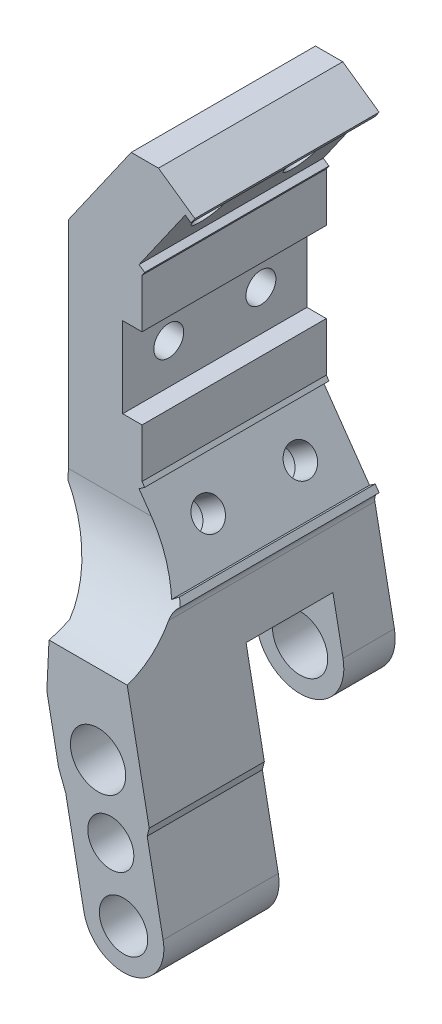
from build123d import *

# Parameters (mm, degrees)
SKETCH_1_R                = 12.000000000000052
EXTRUDE_1_DEPTH           = 110
SKETCH_79_R               = 10.500000000000002
CUT_EXTRUDE_45_DEPTH      = 119.99999999999999
EXTRUDE_2_DEPTH           = 110
CUT_EXTRUDE_46_DEPTH      = 89
CUT_EXTRUDE_46_DEPTH_BACK = 89
CUT_EXTRUDE_48_DEPTH      = 239.00000000000009
CUT_EXTRUDE_49_DEPTH      = 239.00000000000009
SKETCH_93_R               = 6.500000000000001
SKETCH_93_R_2             = 6.499999999999999
CUT_EXTRUDE_50_DEPTH      = 239.00000000000009
SKETCH_94_R               = 9.999999999999993
SKETCH_94_R_2             = 9.999999999999998
CUT_EXTRUDE_51_DEPTH      = 20
SKETCH_95_R               = 6.500000000000009
SKETCH_95_R_2             = 6.500000000000005
CUT_EXTRUDE_52_DEPTH      = 62.00000000000001
SKETCH_96_R               = 10
SKETCH_96_R_2             = 10.000000000000004
CUT_EXTRUDE_53_DEPTH      = 26
SKETCH_97_R               = 6.500000000000009
SKETCH_97_R_2             = 6.500000000000005
CUT_EXTRUDE_54_DEPTH      = 52.00000000000001
CHAMFER_3_SIZE            = 15
CHAMFER_3_SIZE2           = 6.9946148723250126
CUT_EXTRUDE_56_DEPTH      = 40.000000000000014
CHAMFER_4_SIZE            = 17
CHAMFER_4_SIZE2           = 2.99755867204391
CUT_EXTRUDE_57_DEPTH      = 99.99999999999999
CUT_EXTRUDE_60_DEPTH      = 311.81665269220883
CUT_EXTRUDE_61_DEPTH      = 30
FILLET_5_R                = 19
SKETCH_106_R              = 2
SKETCH_106_R_2            = 2.0000000000000018
CUT_EXTRUDE_62_DEPTH      = 9.999999999999996
EXTRUDE_3_DEPTH           = 50
EXTRUDE_4_DEPTH           = 80
SKETCH_110_R              = 6.500000000000003
SKETCH_110_R_2            = 6.500000000000009
CUT_EXTRUDE_63_DEPTH      = 80
SKETCH_111_R              = 9.999999999999996
SKETCH_111_R_2            = 9.999999999999993
CUT_EXTRUDE_64_DEPTH      = 18
FILLET_7_R                = 40
CUT_EXTRUDE_65_DEPTH      = 313.378967275511
CUT_EXTRUDE_66_DEPTH      = 313.378967275511
SKETCH_114_R              = 10
CUT_EXTRUDE_67_DEPTH      = 313.378967275511
CUT_EXTRUDE_68_DEPTH      = 304.118160452512
CUT_EXTRUDE_69_DEPTH      = 313.378967275511
FILLET_8_R                = 4


# Some blends are built 0.0001 mm under size
with BuildPart() as part:
    # 草图1 → 拉伸1 (new body)
    with BuildSketch(Plane.XY):
        with BuildLine():
            Line((-28.976730988546294, -151.6118545806237), (-4.886520661802549, -186.0162404407615))
            Line((-4.886520661802549, -186.0162404407615), (12.286288922085955, -274.36268695105133))
            ThreePointArc((12.286288922085955, -274.36268695105133), (31.04526778327323, -287.0157779601894), (43.69835879241124, -268.2567990990021))
            Line((43.69835879241124, -268.2567990990021), (21.02326901145373, -151.60357490388574))
            Line((21.02326901145373, -151.60357490388574), (6.0232690114537295, -130.18135480275444))
            Line((6.0232690114537295, -130.18135480275444), (6.023269011453701, -52.647312191388025))
            Line((6.023269011453701, -52.647312191388025), (28.96632646549536, -19.88123041982822))
            Line((28.96632646549536, -19.88123041982822), (0.2960049153805317, 0.19394485245823218))
            Line((0.2960049153805317, 0.19394485245823218), (-28.976730988546297, -41.61185458062371))
            Line((-28.976730988546297, -41.61185458062371), (-28.976730988546294, -151.6118545806237))
        make_face()
        with Locations((16.925402125409377, -214.37536638506216)):
            Circle(SKETCH_1_R, mode=Mode.SUBTRACT)
    extrude(amount=EXTRUDE_1_DEPTH)

    # 草图79 → 切除-拉伸45 (cut)
    with BuildSketch(Plane.XY.offset(110)):
        with Locations((27.992323857248604, -271.30974302502676)):
            Circle(SKETCH_79_R)
    extrude(amount=-CUT_EXTRUDE_45_DEPTH, mode=Mode.SUBTRACT)

    # 草图84 → 拉伸2 (add)
    with BuildSketch(Plane.XY.offset(110)):
        Polygon((33.77886656613756, -180.53953408076273), (44.27305222911856, -234.5274390775936), (37.40166194498491, -235.86310204522937), (21.02326901145373, -151.60357490388574), (30.894607438439262, -165.70130720226234), align=None)
        Polygon((5.989592074660176, -241.96898989727842), (3.0447105243171797, -242.54141688340803), (-9.11709427336755, -179.97435517002904), (-4.886520661802549, -186.0162404407615), (-4.169019446852941, -189.7074641975933), align=None)
    extrude(amount=-EXTRUDE_2_DEPTH)

    # 草图87 → 切除-拉伸46 (cut, two sides: drawn at the far end of the back side and taken through both)
    with BuildSketch(Plane(origin=(-8.13799706766443, -1.5818663857744035, 0), x_dir=(0, 0, -1), z_dir=(0.9816271834476652, 0.1908089953765384, 0)).offset(-CUT_EXTRUDE_46_DEPTH_BACK)):
        Polygon((-60, -287.6662060810232), (-60, -190.66620608102318), (-22.300000000000004, -190.66620608102318), (-22.299999999999986, -287.6662060810232), align=None)
    extrude(amount=CUT_EXTRUDE_46_DEPTH + CUT_EXTRUDE_46_DEPTH_BACK, mode=Mode.SUBTRACT)

    # 草图91 → 切除-拉伸48 (cut)
    with BuildSketch(Plane(origin=(0, 0, 0), x_dir=(-1, 0, 0), z_dir=(0, 0, -1))):
        Polygon((-27.245597156442233, -22.338686552695204), (-24.78814102357525, -20.61795724364208), (-4.7129657512888, -49.2882787937569), (-7.170421884155786, -51.009008102810036), align=None)
        Polygon((-7.170421884155786, -131.81965889133244), (-27.245597156442233, -160.48998044144724), (-24.78814102357525, -162.21070975050037), (-4.7129657512888, -133.54038820038556), align=None)
    extrude(amount=-CUT_EXTRUDE_48_DEPTH, mode=Mode.SUBTRACT)

    # 草图92 → 切除-拉伸49 (cut)
    with BuildSketch(Plane.XY.offset(110)):
        Polygon((6.0232690114537295, -73.91433349707123), (-2.3767309885462713, -73.91433349707123), (-2.3767309885462713, -108.91433349707124), (6.023269011453734, -108.91433349707124), align=None)
    extrude(amount=-CUT_EXTRUDE_49_DEPTH, mode=Mode.SUBTRACT)

    # 草图93 → 切除-拉伸50 (cut)
    with BuildSketch(Plane(origin=(26.320363423382695, -18.429716877471463, 0), x_dir=(0, 0, -1), z_dir=(0.819152044288995, -0.5735764363510417, 0))):
        with Locations(Location((-60, -20.171348233123158, 0), (0, 0, 90))):
            Circle(SKETCH_93_R)
        with Locations(Location((-20.000000000000004, -20.171348233123165, 0), (0, 0, 90))):
            Circle(SKETCH_93_R_2)
    extrude(amount=-CUT_EXTRUDE_50_DEPTH, mode=Mode.SUBTRACT)

    # 草图94 → 切除-拉伸51 (cut)
    with BuildSketch(Plane(origin=(0.10749800613483755, -0.07527091423812596, 0), x_dir=(0, 0, 1), z_dir=(-0.8191520442889949, 0.5735764363510415, 0))):
        with Locations(Location((60, -20.171348233123386, 0), (0, 0, 270))):
            Circle(SKETCH_94_R)
        with Locations(Location((20, -20.17134823312372, 0), (0, 0, 270))):
            Circle(SKETCH_94_R_2)
    extrude(amount=-CUT_EXTRUDE_51_DEPTH, mode=Mode.SUBTRACT)

    # 草图95 → 切除-拉伸52 (cut)
    with BuildSketch(Plane(origin=(-59.58101119787688, -41.71907317491003, 0), x_dir=(0, 0, -1), z_dir=(0.8191520442889946, 0.5735764363510422, 0))):
        with Locations(Location((-60, -129.59312808976054, 0), (0, 0, 90))):
            Circle(SKETCH_95_R)
        with Locations(Location((-20, -129.59312808976054, 0), (0, 0, 90))):
            Circle(SKETCH_95_R_2)
    extrude(amount=-CUT_EXTRUDE_52_DEPTH, mode=Mode.SUBTRACT)

    # 草图96 → 切除-拉伸53 (cut)
    with BuildSketch(Plane(origin=(-90.67794882371814, -63.493383315761, 0), x_dir=(0, 0, 1), z_dir=(-0.819152044288995, -0.5735764363510415, 0))):
        with Locations(Location((20, -129.59312808976054, 0), (0, 0, 270))):
            Circle(SKETCH_96_R)
        with Locations(Location((60.00000000000001, -129.59312808976054, 0), (0, 0, 270))):
            Circle(SKETCH_96_R_2)
    extrude(amount=-CUT_EXTRUDE_53_DEPTH, mode=Mode.SUBTRACT)

    # 草图97 → 切除-拉伸54 (cut)
    with BuildSketch(Plane(origin=(-2.3767309885462713, 0, 0), x_dir=(0, 0, -1), z_dir=(1, 0, 0))):
        with Locations((-60, -91.41433349707123)):
            Circle(SKETCH_97_R)
        with Locations((-20, -91.41433349707123)):
            Circle(SKETCH_97_R_2)
    extrude(amount=-CUT_EXTRUDE_54_DEPTH, mode=Mode.SUBTRACT)

    # 倒角3
    chamfer_3_edges = [part.edges().sort_by_distance(p)[0] for p in [
        (44.27305222911856, -234.5274390775936, 85),
    ]]
    chamfer_3_side = [part.faces().sort_by_distance(p)[0] for p in [
        (44.02415054875298, -233.24695093828697, 85),
    ]]
    chamfer(chamfer_3_edges, length=CHAMFER_3_SIZE, length2=CHAMFER_3_SIZE2, reference=chamfer_3_side[0])

    # 草图100 → 切除-拉伸56 (cut)
    with BuildSketch(Plane(origin=(0, 0, 0), x_dir=(-1, 0, 0), z_dir=(0, 0, -1))):
        Polygon((-44.27305222911856, -234.52743907759367), (6.1852097610321, -243.4245920661131), (-1.3934863042614487, -301.9028620974419), (-49.163357209015906, -290.65730281259704), align=None)
    extrude(amount=-CUT_EXTRUDE_56_DEPTH, mode=Mode.SUBTRACT)

    # 倒角4
    chamfer_4_edges = [part.edges().sort_by_distance(p)[0] for p in [
        (3.0447105243171797, -242.54141688340803, 85),
    ]]
    chamfer_4_side = [part.faces().sort_by_distance(p)[0] for p in [
        (-3.0361918745251857, -211.25788602671855, 108.72867994952558),
    ]]
    chamfer(chamfer_4_edges, length=CHAMFER_4_SIZE, length2=CHAMFER_4_SIZE2, reference=chamfer_4_side[0])

    # 草图101 → 切除-拉伸57 (cut)
    with BuildSketch(Plane.ZY.offset(28.976730988546297)):
        Polygon((80, 0.19394485245823218), (80.00000000000003, -179.97435517002904), (110, -179.97435517002904), (110, 0.19394485245823218), align=None)
    extrude(amount=-CUT_EXTRUDE_57_DEPTH, mode=Mode.SUBTRACT)

    # 草图104 → 切除-拉伸60 (cut, through all)
    with BuildSketch(Plane(origin=(0, 0, 0), x_dir=(-1, 0, 0), z_dir=(0, 0, -1))):
        Polygon((-32.2371611918256, -193.57151976257379), (-38.9154760300042, -227.92847118324212), (-40.33322116171547, -235.2221375942102), (-44.27305222911856, -234.52743907759367), (-30.894607438439262, -165.70130720226234), (-28.966326465495353, -162.94743657431422), align=None)
    extrude(amount=-CUT_EXTRUDE_60_DEPTH, mode=Mode.SUBTRACT)

    # 草图105 → 切除-拉伸61 (cut)
    with BuildSketch(Plane(origin=(0, 0, 0), x_dir=(-1, 0, 0), z_dir=(0, 0, -1))):
        Polygon((-20.550773037563566, -233.02628287056783), (19.175397031592663, -240.74826808946762), (4.5304915840304885, -248.72140725810314), (-58.40232940975858, -238.94714512920513), (-58.40232940975858, -225.6686856415971), align=None)
    extrude(amount=-CUT_EXTRUDE_61_DEPTH, mode=Mode.SUBTRACT)

    # 圆角5
    fillet_5_edges = [part.edges().sort_by_distance(p)[0] for p in [
        (1.8998565520579558, -236.651653782722, 11.149999999999999),
        (39.20168952306901, -229.40091195841367, 11.150000000000002),
    ]]
    fillet(fillet_5_edges, radius=FILLET_5_R - 0.0001)  # a hair under: the kernel refuses the full size

    # 草图106 → 切除-拉伸62 (cut)
    with BuildSketch(Plane(origin=(0, 0, 0), x_dir=(-1, 0, 0), z_dir=(0, 0, -1))):
        with Locations((-14.063267194761234, -199.6509586333472)):
            Circle(SKETCH_106_R)
        with Locations(Location((-19.78753705605748, -229.0997741367771, 0), (0, 0, 180))):
            Circle(SKETCH_106_R_2)
    extrude(amount=-CUT_EXTRUDE_62_DEPTH, mode=Mode.SUBTRACT)

    # 草图108 → 拉伸3 (add)
    with BuildSketch(Plane(origin=(0, 0, 60), x_dir=(-1, 0, 0), z_dir=(0, 0, -1))):
        with BuildLine():
            Line((-38.26406077084946, -232.42438348743354), (-37.40166194498552, -235.8631020452294))
            Line((-37.40166194498552, -235.8631020452294), (-43.69835879241125, -268.25679909900214))
            ThreePointArc((-43.69835879241125, -268.25679909900214), (-31.045267783273236, -287.0157779601894), (-12.286288922085975, -274.3626869510514))
            Line((-12.286288922085975, -274.3626869510514), (-5.989592074660176, -241.96898989727842))
            Line((-5.989592074660176, -241.96898989727842), (-2.8958579304012813, -233.91437207733833))
            Line((-2.8958579304012813, -233.91437207733833), (-3.4359003256881757, -236.69264935080582))
            Line((-3.4359003256881757, -236.69264935080582), (-10.813848146914486, -274.64890044411624))
            ThreePointArc((-10.813848146914486, -274.64890044411624), (-31.331481276338053, -288.4882187353609), (-45.170799567582726, -267.97058560593734))
            Line((-45.170799567582726, -267.97058560593734), (-38.26406077084946, -232.42438348743354))
        make_face()
    extrude(amount=-EXTRUDE_3_DEPTH)

    # 草图109 → 拉伸4 (add)
    with BuildSketch(Plane(origin=(0, 0, 0), x_dir=(-1, 0, 0), z_dir=(0, 0, -1))):
        Polygon((28.976730988546297, -41.61185458062371), (31.976730988546294, -45.8962986008501), (31.976730988546283, -147.3274105603974), (28.976730988546294, -151.6118545806237), align=None)
    extrude(amount=-EXTRUDE_4_DEPTH)

    # 草图110 → 切除-拉伸63 (cut)
    with BuildSketch(Plane(origin=(-2.3767309885462713, 0, 0), x_dir=(0, 0, -1), z_dir=(1, 0, 0))):
        with Locations((-60, -91.41433349707123)):
            Circle(SKETCH_110_R)
        with Locations((-20, -91.41433349707123)):
            Circle(SKETCH_110_R_2)
    extrude(amount=-CUT_EXTRUDE_63_DEPTH, mode=Mode.SUBTRACT)

    # 草图111 → 切除-拉伸64 (cut)
    with BuildSketch(Plane.ZY.offset(31.9767309885463)):
        with Locations(Location((20, -91.41433349707123, 0), (0, 0, 270))):
            Circle(SKETCH_111_R)
        with Locations(Location((60, -91.41433349707123, 0), (0, 0, 270))):
            Circle(SKETCH_111_R_2)
    extrude(amount=-CUT_EXTRUDE_64_DEPTH, mode=Mode.SUBTRACT)

    # 圆角7
    # the kernel refuses this fillet: 40 mm, written as the material it adds along each edge
    with BuildSketch(Plane(origin=(-105.94167792855299, -179.97435517002904, 80.00000000000003), x_dir=(0, 0, 1), z_dir=(1, 3e-17, 0))) as fillet_7_piece_1_section:
        with BuildLine():
            CenterArc((40, -38.72983346207417), FILLET_7_R, 104.47751218592997, 75.52248781407003)
            Line((0, -38.72983346207417), (-0.7999999999999972, -38.72983346207417))
            Line((-0.7999999999999972, -38.72983346207417), (-0.7999999999999972, 0))
            Line((-0.7999999999999972, 0), (0, 0.8000000000000114))
            ThreePointArc((0, 0.8000000000000114), (14.999999999999986, 0.8000000000000114), (29.79999999999997, 0.7745966692414754))
            Line((29.79999999999997, 0.7745966692414754), (29.99999999999997, 0))
        make_face()
    fillet_7_piece_1 = extrude(amount=233.55116450368297, mode=Mode.PRIVATE)
    fillet_7_piece_1 = split(fillet_7_piece_1, bisect_by=Plane(origin=(-12.51953329492531, -162.47032383757914, 83.83192284371052), z_dir=(-0.9816271834476656, -0.19080899537653592, 0)), keep=Keep.TOP, mode=Mode.PRIVATE)
    fillet_7_piece_1 = split(fillet_7_piece_1, bisect_by=Plane(origin=(-19.41668158240532, -165.26502008436023, 83.83192284371052), z_dir=(0.8191520442889951, 0.5735764363510417, 0)), keep=Keep.TOP, mode=Mode.PRIVATE)
    fillet_7_piece_1 = split(fillet_7_piece_1, bisect_by=Plane(origin=(-31.976730988546283, -163.2522374406607, 83.83192284371052), z_dir=(1, 1.1e-16, 0)), keep=Keep.TOP, mode=Mode.PRIVATE)
    add(fillet_7_piece_1)
    with BuildSketch(Plane(origin=(-105.94167792855299, -179.97435517002904, 80.00000000000003), x_dir=(0, 0, 1), z_dir=(1, 3e-17, 0))) as fillet_7_piece_2_section:
        with BuildLine():
            CenterArc((40, -38.72983346207417), FILLET_7_R, 104.47751218592997, 75.52248781407003)
            Line((0, -38.72983346207417), (-0.7999999999999972, -38.72983346207417))
            Line((-0.7999999999999972, -38.72983346207417), (-0.7999999999999972, 0))
            Line((-0.7999999999999972, 0), (0, 0.8000000000000114))
            ThreePointArc((0, 0.8000000000000114), (14.999999999999986, 0.8000000000000114), (29.79999999999997, 0.7745966692414754))
            Line((29.79999999999997, 0.7745966692414754), (29.99999999999997, 0))
        make_face()
    fillet_7_piece_2 = extrude(amount=233.55116450368297, mode=Mode.PRIVATE)
    fillet_7_piece_2 = split(fillet_7_piece_2, bisect_by=Plane(origin=(-11.0823601563293, -169.86393867938824, 85.67329345613419), z_dir=(0.9816271834476656, 0.19080899537653592, 0)), keep=Keep.TOP, mode=Mode.PRIVATE)
    fillet_7_piece_2 = split(fillet_7_piece_2, bisect_by=Plane(origin=(-11.613613613415541, -176.40895605074635, 85.67329345613419), z_dir=(0.8191520442889951, 0.5735764363510417, 0)), keep=Keep.TOP, mode=Mode.PRIVATE)
    fillet_7_piece_2 = split(fillet_7_piece_2, bisect_by=Plane(origin=(6.426287216684376, -175.0678182015899, 85.67329345613419), z_dir=(-0.5735764363510422, 0.8191520442889946, 0)), keep=Keep.TOP, mode=Mode.PRIVATE)
    fillet_7_piece_2 = split(fillet_7_piece_2, bisect_by=Plane(origin=(19.483324012425726, -154.63464590989543, 85.67329345613419), z_dir=(-0.819152044288995, -0.5735764363510418, 0)), keep=Keep.TOP, mode=Mode.PRIVATE)
    add(fillet_7_piece_2)
    with BuildSketch(Plane(origin=(-105.94167792855299, -179.97435517002904, 80.00000000000003), x_dir=(0, 0, 1), z_dir=(1, 3e-17, 0))) as fillet_7_piece_3_section:
        with BuildLine():
            CenterArc((40, -38.72983346207417), FILLET_7_R, 104.47751218592997, 75.52248781407003)
            Line((0, -38.72983346207417), (-0.7999999999999972, -38.72983346207417))
            Line((-0.7999999999999972, -38.72983346207417), (-0.7999999999999972, 0))
            Line((-0.7999999999999972, 0), (0, 0.8000000000000114))
            ThreePointArc((0, 0.8000000000000114), (14.999999999999986, 0.8000000000000114), (29.79999999999997, 0.7745966692414754))
            Line((29.79999999999997, 0.7745966692414754), (29.99999999999997, 0))
        make_face()
    fillet_7_piece_3 = extrude(amount=233.55116450368297, mode=Mode.PRIVATE)
    fillet_7_piece_3 = split(fillet_7_piece_3, bisect_by=Plane(origin=(-9.009356536559622, -180.52861777659584, 94.6402069823871), z_dir=(0.9816271834476656, 0.19080899537653592, 0)), keep=Keep.TOP, mode=Mode.PRIVATE)
    fillet_7_piece_3 = split(fillet_7_piece_3, bisect_by=Plane(origin=(-8.79058085805184, -180.44066465328677, 94.6402069823871), z_dir=(-0.8191520442889951, -0.5735764363510417, 0)), keep=Keep.TOP, mode=Mode.PRIVATE)
    add(fillet_7_piece_3)
    with BuildSketch(Plane(origin=(-105.94167792855299, -179.97435517002904, 80.00000000000003), x_dir=(0, 0, 1), z_dir=(1, 3e-17, 0))) as fillet_7_piece_4_section:
        with BuildLine():
            CenterArc((40, -38.72983346207417), FILLET_7_R, 104.47751218592997, 75.52248781407003)
            Line((0, -38.72983346207417), (-0.7999999999999972, -38.72983346207417))
            Line((-0.7999999999999972, -38.72983346207417), (-0.7999999999999972, 0))
            Line((-0.7999999999999972, 0), (0, 0.8000000000000114))
            ThreePointArc((0, 0.8000000000000114), (14.999999999999986, 0.8000000000000114), (29.79999999999997, 0.7745966692414754))
            Line((29.79999999999997, 0.7745966692414754), (29.99999999999997, 0))
        make_face()
    fillet_7_piece_4 = extrude(amount=233.55116450368297, mode=Mode.PRIVATE)
    fillet_7_piece_4 = split(fillet_7_piece_4, bisect_by=Plane(origin=(30.19560853374157, -174.4569255792952, 90.20338690040074), z_dir=(-0.9943445829779457, -0.10620193172638355, 0)), keep=Keep.TOP, mode=Mode.PRIVATE)
    fillet_7_piece_4 = split(fillet_7_piece_4, bisect_by=Plane(origin=(13.740886571539868, -169.94608059433625, 90.20338690040074), z_dir=(0.5735764363510422, -0.8191520442889946, 0)), keep=Keep.TOP, mode=Mode.PRIVATE)
    fillet_7_piece_4 = split(fillet_7_piece_4, bisect_by=Plane(origin=(28.871851379638382, -168.04285255562414, 90.20338690040074), z_dir=(-0.819152044288995, -0.5735764363510418, 0)), keep=Keep.TOP, mode=Mode.PRIVATE)
    add(fillet_7_piece_4)
    with BuildSketch(Plane(origin=(-105.94167792855299, -179.97435517002904, 80.00000000000003), x_dir=(0, 0, 1), z_dir=(1, 3e-17, 0))) as fillet_7_piece_5_section:
        with BuildLine():
            CenterArc((40, -38.72983346207417), FILLET_7_R, 104.47751218592997, 75.52248781407003)
            Line((0, -38.72983346207417), (-0.7999999999999972, -38.72983346207417))
            Line((-0.7999999999999972, -38.72983346207417), (-0.7999999999999972, 0))
            Line((-0.7999999999999972, 0), (0, 0.8000000000000114))
            ThreePointArc((0, 0.8000000000000114), (14.999999999999986, 0.8000000000000114), (29.79999999999997, 0.7745966692414754))
            Line((29.79999999999997, 0.7745966692414754), (29.99999999999997, 0))
        make_face()
    fillet_7_piece_5 = extrude(amount=233.55116450368297, mode=Mode.PRIVATE)
    fillet_7_piece_5 = split(fillet_7_piece_5, bisect_by=Plane(origin=(29.096200093249962, -164.1634138746349, 83.30336124408971), z_dir=(-0.9943445829779457, -0.10620193172638355, 0)), keep=Keep.TOP, mode=Mode.PRIVATE)
    fillet_7_piece_5 = split(fillet_7_piece_5, bisect_by=Plane(origin=(29.191650794636054, -163.26923306584595, 83.30336124408971), z_dir=(-0.8191520442889866, -0.5735764363510536, 0)), keep=Keep.TOP, mode=Mode.PRIVATE)
    fillet_7_piece_5 = split(fillet_7_piece_5, bisect_by=Plane(origin=(25.755904268821425, -161.5330746309767, 83.30336124408971), z_dir=(0.5735764363510422, -0.8191520442889946, 0)), keep=Keep.TOP, mode=Mode.PRIVATE)
    fillet_7_piece_5 = split(fillet_7_piece_5, bisect_by=Plane(origin=(26.734194661768576, -164.98996237489945, 83.30336124408971), z_dir=(0.819152044288995, 0.5735764363510418, 0)), keep=Keep.TOP, mode=Mode.PRIVATE)
    add(fillet_7_piece_5)

    # 草图112 → 切除-拉伸65 (cut, through all)
    with BuildSketch(Plane(origin=(0, 0, 0), x_dir=(-1, 0, 0), z_dir=(0, 0, -1))):
        Polygon((-5.210917181114502, -3.2475137656480166), (-0.2960049153805317, 0.19394485245823218), (31.976730988546294, -45.8962986008501), (31.976730988546283, -147.3274105603974), (9.11709427336755, -179.97435517002904), (4.202182007633583, -176.5328965519228), (25.976730988546286, -145.43561782712348), (25.976730988546297, -47.78809133412398), align=None)
    extrude(amount=-CUT_EXTRUDE_65_DEPTH, mode=Mode.SUBTRACT)

    # 草图113 → 切除-拉伸66 (cut, through all)
    with BuildSketch(Plane(origin=(0, 0, 0), x_dir=(-1, 0, 0), z_dir=(0, 0, -1))):
        Polygon((4.202182007633583, -176.5328965519228), (5.300914365836831, -199.60689883898237), (9.11709427336755, -179.97435517002904), align=None)
    extrude(amount=-CUT_EXTRUDE_66_DEPTH, mode=Mode.SUBTRACT)

    # 草图114 → 切除-拉伸67 (cut, through all)
    with BuildSketch(Plane.XY.offset(110)):
        with Locations((22.458862991328992, -242.84255470504445)):
            Circle(SKETCH_114_R)
    extrude(amount=-CUT_EXTRUDE_67_DEPTH, mode=Mode.SUBTRACT)

    # 草图116 → 切除-拉伸68 (cut, through all)
    with BuildSketch(Plane.XY.offset(80)):
        Polygon((27.99232385724879, -8.809743025026629), (-43.313363791080114, -8.809743025026629), (15.890775135972119, 7.728361064580753), align=None)
    extrude(amount=-CUT_EXTRUDE_68_DEPTH, mode=Mode.SUBTRACT)

    # 草图117 → 切除-拉伸69 (cut, through all)
    with BuildSketch(Plane(origin=(0, 0, 0), x_dir=(-1, 0, 0), z_dir=(0, 0, -1))):
        Polygon((-32.2371611918256, -193.57151976257379), (-26.873586432564615, -165.97831969485938), (-26.60573448352246, -164.60034087472903), (-28.966326465495353, -162.94743657431422), align=None)
    extrude(amount=-CUT_EXTRUDE_69_DEPTH, mode=Mode.SUBTRACT)

    # 圆角8
    fillet_8_edges = [part.edges().sort_by_distance(p)[0] for p in [
        (26.60573448352246, -164.60034087472903, 43.763423151346345),
    ]]
    fillet(fillet_8_edges, radius=FILLET_8_R)


solid = part.part
